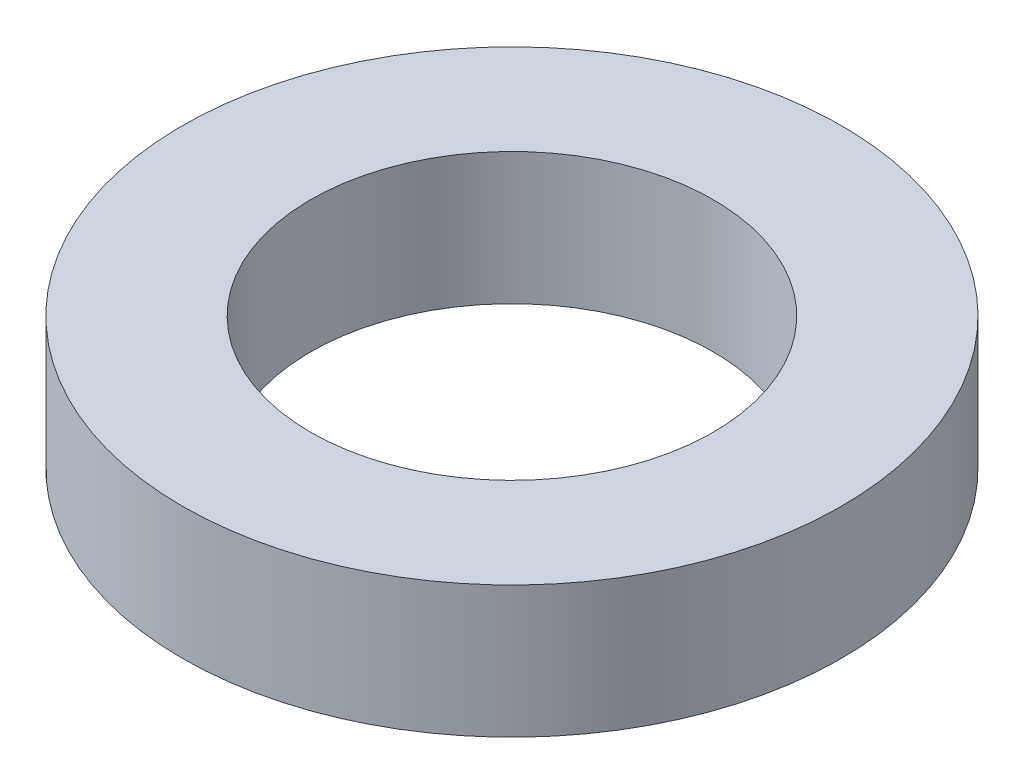
from build123d import *

# Parameters (mm, degrees)
SKETCH1_R           = 45
BOSS_EXTRUDE1_DEPTH = 18
SKETCH2_R           = 27.5
CUT_EXTRUDE1_DEPTH  = 67.136223055


with BuildPart() as part:
    # Sketch1 → Boss-Extrude1 (new body)
    with BuildSketch(Plane(origin=(0, 0, 0), x_dir=(1, 0, 0), z_dir=(0, 1, 0))):
        Circle(SKETCH1_R)
    extrude(amount=BOSS_EXTRUDE1_DEPTH)

    # Sketch2 → Cut-Extrude1 (cut, through all)
    with BuildSketch(Plane(origin=(0, 0, 0), x_dir=(1, 0, 0), z_dir=(0, 1, 0))):
        Circle(SKETCH2_R)
    extrude(amount=CUT_EXTRUDE1_DEPTH, mode=Mode.SUBTRACT)


solid = part.part
